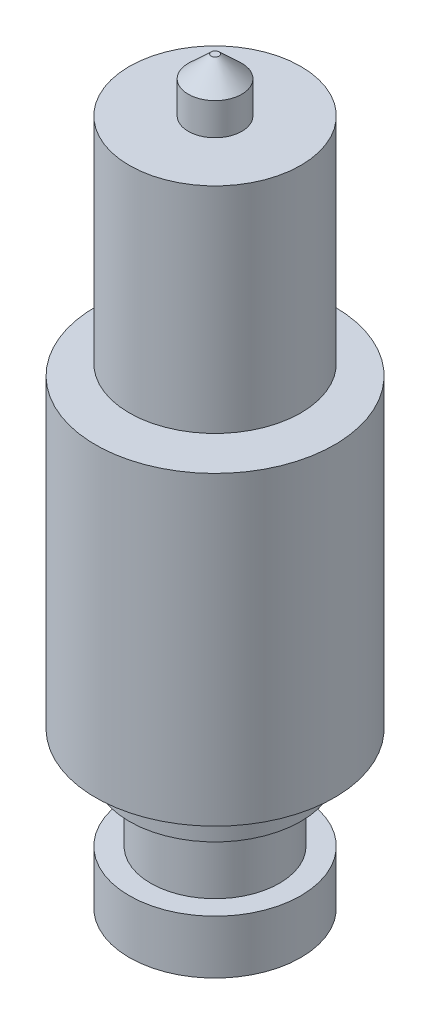
from build123d import *

# Parameters (mm, degrees)
SKETCH1_R           = 8
BOSS_EXTRUDE1_DEPTH = 5
SKETCH2_R           = 6
BOSS_EXTRUDE2_DEPTH = 6
SKETCH3_R           = 8
BOSS_EXTRUDE3_DEPTH = 1.5
SKETCH4_R           = 5
BOSS_EXTRUDE4_DEPTH = 2
SKETCH5_R           = 11.15
BOSS_EXTRUDE5_DEPTH = 28.5
SKETCH6_R           = 2
BOSS_EXTRUDE6_DEPTH = 1
SKETCH7_R           = 8
BOSS_EXTRUDE7_DEPTH = 20
SKETCH8_R           = 2.5
BOSS_EXTRUDE8_DEPTH = 3
SKETCH9_R           = 2.5
BOSS_EXTRUDE9_DEPTH = 2
BOSS_EXTRUDE9_TAPER = 47


with BuildPart() as part:
    # Sketch1 → Boss-Extrude1 (new body)
    with BuildSketch(Plane(origin=(0, 0, 0), x_dir=(1, 0, 0), z_dir=(0, 1, 0))):
        Circle(SKETCH1_R)
    extrude(amount=BOSS_EXTRUDE1_DEPTH)

    # Sketch2 → Boss-Extrude2 (add)
    with BuildSketch(Plane(origin=(0, 5, 0), x_dir=(1, 0, 0), z_dir=(0, 1, 0))):
        Circle(SKETCH2_R)
    extrude(amount=BOSS_EXTRUDE2_DEPTH)

    # Sketch3 → Boss-Extrude3 (add)
    with BuildSketch(Plane(origin=(0, 11, 0), x_dir=(1, 0, 0), z_dir=(0, 1, 0))):
        Circle(SKETCH3_R)
    extrude(amount=BOSS_EXTRUDE3_DEPTH)

    # Sketch4 → Boss-Extrude4 (add)
    with BuildSketch(Plane(origin=(0, 12.5, 0), x_dir=(1, 0, 0), z_dir=(0, 1, 0))):
        Circle(SKETCH4_R)
    extrude(amount=BOSS_EXTRUDE4_DEPTH)

    # Sketch5 → Boss-Extrude5 (add)
    with BuildSketch(Plane(origin=(0, 14.5, 0), x_dir=(1, 0, 0), z_dir=(0, 1, 0))):
        Circle(SKETCH5_R)
    extrude(amount=BOSS_EXTRUDE5_DEPTH)

    # Sketch6 → Boss-Extrude6 (add)
    with BuildSketch(Plane(origin=(0, 43, 0), x_dir=(1, 0, 0), z_dir=(0, 1, 0))):
        Circle(SKETCH6_R)
    extrude(amount=BOSS_EXTRUDE6_DEPTH)

    # Sketch7 → Boss-Extrude7 (add)
    with BuildSketch(Plane(origin=(0, 44, 0), x_dir=(1, 0, 0), z_dir=(0, 1, 0))):
        Circle(SKETCH7_R)
    extrude(amount=BOSS_EXTRUDE7_DEPTH)

    # Sketch8 → Boss-Extrude8 (add)
    with BuildSketch(Plane(origin=(0, 64, 0), x_dir=(1, 0, 0), z_dir=(0, 1, 0))):
        Circle(SKETCH8_R)
    extrude(amount=BOSS_EXTRUDE8_DEPTH)

    # Sketch9 → Boss-Extrude9 (add)
    with BuildSketch(Plane(origin=(0, 67, 0), x_dir=(1, 0, 0), z_dir=(0, 1, 0))):
        Circle(SKETCH9_R)
    extrude(amount=BOSS_EXTRUDE9_DEPTH, taper=BOSS_EXTRUDE9_TAPER)


solid = part.part
